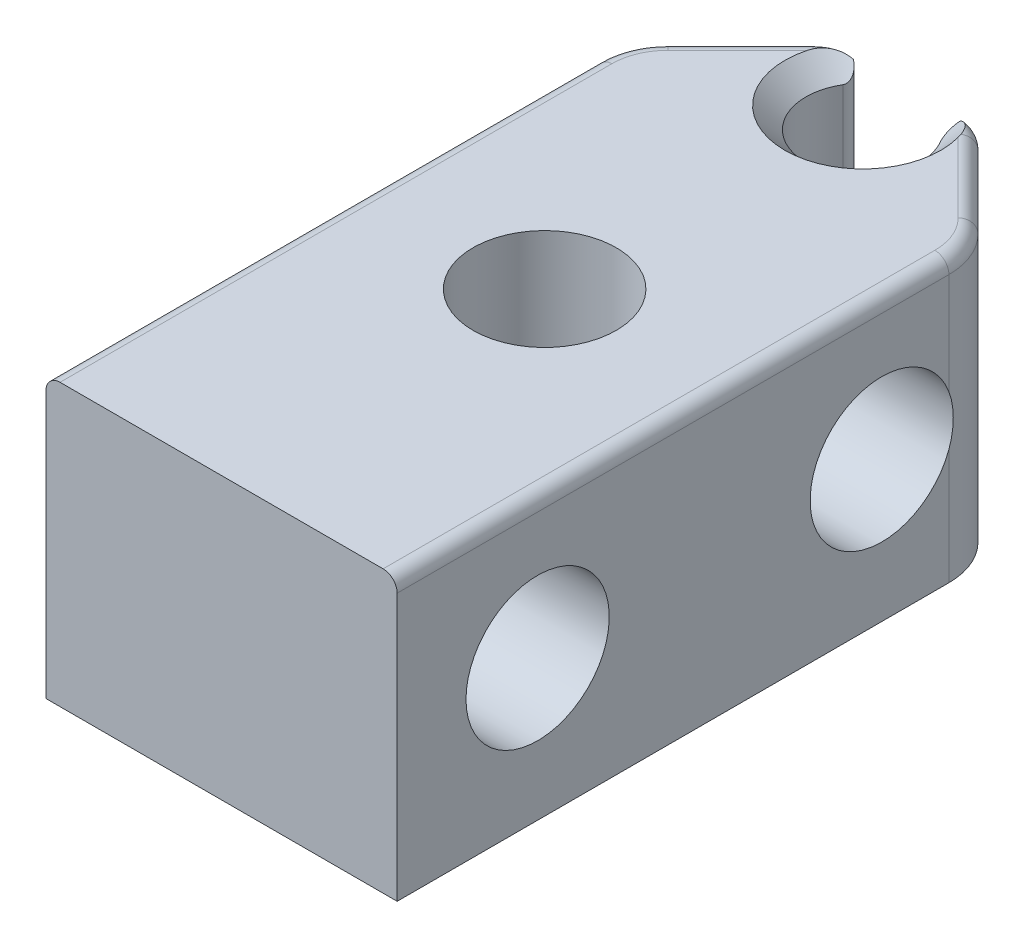
from build123d import *
from OCP.BRepAlgoAPI import BRepAlgoAPI_Cut
from OCP.TopTools import TopTools_ListOfShape

# Parameters (mm, degrees)
SZKIC1_W                               = 25
SZKIC1_H                               = 20
DODANIE_WYCI_GNI_CIE1_DEPTH            = 42.5
WYTNIJ_WYCI_GNI_CIE1_REACH             = 52.312
SZKIC2_R                               = 5.1
WYTNIJ_WYCI_GNI_CIE2_REACH             = 50.606
SZKIC3_R                               = 5.1
DODANIE_WYCI_GNI_CIE2_START            = -20
DODANIE_WYCI_GNI_CIE2_DEPTH            = 20
ZAOKR_GLENIE2_R                        = 0.75
SZKIC7_W                               = 25
SZKIC7_H                               = 15
DODANIE_WYCI_GNI_CIE3_DEPTH            = 2
WYTNIJ_WYCI_GNI_CIE4_REACH             = 49.817
SZKIC8_R                               = 4.05
SFAZOWANIE1_SIZE                       = 7.5
WYCI_CIE_WYCI_GNI_CIE_START            = 5.5
WYCI_CIE_WYCI_GNI_CIE_PO_CIE_CE1_DEPTH = 3
ZAOKR_GLENIE3_R                        = 2
ZAOKR_GLENIE4_START                    = -11
ZAOKR_GLENIE4_DEPTH                    = 22
ZAOKR_GLENIE3_OF_LUSTRO2_R             = 2
ZAOKR_GLENIE5_R                        = 5
ZAOKR_GLENIE6_R                        = 1
SFAZOWANIE2_SIZE                       = 1.5
WYTNIJ_WYCI_GNI_CIE5_REACH             = 52.312
SZKIC12_R                              = 5.1


with BuildPart() as part:
    # Szkic1 → Dodanie-wyciągnięcie1 (new body)
    with BuildSketch(Plane.XY):
        Rectangle(SZKIC1_W, SZKIC1_H)
    extrude(amount=DODANIE_WYCI_GNI_CIE1_DEPTH)

    # Szkic2 → Wytnij-wyciągnięcie1 (cut, up to next)
    with BuildSketch(Plane(origin=(12.5, 0, 0), x_dir=(0, 0, -1), z_dir=(1, 0, 0)), mode=Mode.PRIVATE) as wytnij_wyci_gni_cie1_sk1:
        with Locations((-8, 0)):
            Circle(SZKIC2_R)
    wytnij_wyci_gni_cie1_tool1 = extrude(wytnij_wyci_gni_cie1_sk1.sketch, amount=-WYTNIJ_WYCI_GNI_CIE1_REACH, mode=Mode.PRIVATE) & part.part
    add(wytnij_wyci_gni_cie1_tool1.solids().sort_by_distance((12.5, 0, 8))[0], mode=Mode.SUBTRACT)

    # Szkic3 → Wytnij-wyciągnięcie2 (cut, up to next)
    with BuildSketch(Plane(origin=(0, 10, 0), x_dir=(1, 0, 0), z_dir=(0, 1, 0)), mode=Mode.PRIVATE) as wytnij_wyci_gni_cie2_sk1:
        with Locations(Location((0, -19.5, 0), (0, 0, 270))):
            Circle(SZKIC3_R)
    wytnij_wyci_gni_cie2_tool1 = extrude(wytnij_wyci_gni_cie2_sk1.sketch, amount=-WYTNIJ_WYCI_GNI_CIE2_REACH, mode=Mode.PRIVATE) & part.part
    add(wytnij_wyci_gni_cie2_tool1.solids().sort_by_distance((0, 10, 19.5))[0], mode=Mode.SUBTRACT)

    # Dodanie-wyciągnięcie2: read off the stored shape, not the designer's step
    # Dodanie-wyciągnięcie2 outline → Dodanie-wyciągnięcie2 (add)
    with BuildSketch(Plane(origin=(0, 10, 0), x_dir=(1, 0, 0), z_dir=(0, 1, 0)).offset(DODANIE_WYCI_GNI_CIE2_START)):
        with BuildLine():
            Line((-12.5, 0), (-2.545584412, 0))
            ThreePointArc((-2.545584412, 0), (-4.049799766, 3.19027229), (-2.482438317, 6.35))
            Line((-2.482438317, 6.35), (-12.5, 6.35))
            Line((-12.5, 6.35), (-12.5, 0))
        make_face()
        with BuildLine():
            Line((12.5, 0), (12.5, 6.35))
            Line((12.5, 6.35), (2.482438317, 6.35))
            ThreePointArc((2.482438317, 6.35), (4.049799766, 3.19027229), (2.545584412, 0))
            Line((2.545584412, 0), (12.5, 0))
        make_face()
    extrude(amount=DODANIE_WYCI_GNI_CIE2_DEPTH)

    # Zaokrąglenie2
    zaokr_glenie2_edges = [part.edges().sort_by_distance(p)[0] for p in [
        (-2.482438317, 0, -6.35),
        (2.482438317, 0, -6.35),
    ]]
    fillet(zaokr_glenie2_edges, radius=ZAOKR_GLENIE2_R)

    # Szkic7 → Dodanie-wyciągnięcie3 (add)
    with BuildSketch(Plane.XZ.offset(10)):
        with Locations((0, 1.15)):
            Rectangle(SZKIC7_W, SZKIC7_H)
    extrude(amount=-DODANIE_WYCI_GNI_CIE3_DEPTH)

    # Szkic8 → Wytnij-wyciągnięcie4 (cut, up to next)
    with BuildSketch(Plane(origin=(0, -8, 0), x_dir=(1, 0, 0), z_dir=(0, 1, 0)), mode=Mode.PRIVATE) as wytnij_wyci_gni_cie4_sk1:
        with Locations((0, 3.15)):
            Circle(SZKIC8_R)
    wytnij_wyci_gni_cie4_tool1 = extrude(wytnij_wyci_gni_cie4_sk1.sketch, amount=WYTNIJ_WYCI_GNI_CIE4_REACH, mode=Mode.PRIVATE) & part.part
    add(wytnij_wyci_gni_cie4_tool1.solids().sort_by_distance((0, -8, -3.15))[0], mode=Mode.SUBTRACT)

    # Sfazowanie1
    sfazowanie1_edges = [part.edges().sort_by_distance(p)[0] for p in [
        (-12.5, 0, -6.35),
        (12.5, 0, -6.35),
    ]]
    chamfer(sfazowanie1_edges, length=SFAZOWANIE1_SIZE)


with BuildPart() as wyci_cie_wyci_gni_cie_po_cie_ce1_tool:
    # Wycięcie-wyciągnięcie po ścieżce1: read off the stored shape, not the designer's step
    # Wycięcie-wyciągnięcie po ścieżce1 outlin → Wycięcie-wyciągnięcie po ścieżce1 (new body)
    with BuildSketch(Plane(origin=(0, 0, 0), x_dir=(1, 0, 0), z_dir=(0, 1, 0)).offset(WYCI_CIE_WYCI_GNI_CIE_START)):
        with BuildLine():
            Line((-8.398959236, 2.951040764), (-9.601040764, 1.748959236))
            add(Edge.make_bspline(
                [(-9.601040764, 1.748959236), (-9.209595956, 0.772190109), (-8.65567701, -0.205079485), (-7.121419805, -2.018854383), (-6.15542851, -2.840889353), (-3.89496705, -4.097344098), (-2.618886758, -4.525976788), (0.018436022, -4.858092268), (1.356613032, -4.766181401), (3.844325913, -4.116700841), (4.978679647, -3.572124587), (6.907257886, -2.213562211), (7.697476445, -1.410485572), (8.875702434, 0.189942932), (9.295310391, 0.978883557), (9.600922152, 1.74907375)],
                knots=[0.044527741, 0.044527741, 0.044527741, 0.044527741, 0.163961774, 0.163961774, 0.283395806, 0.283395806, 0.402829838, 0.402829838, 0.522263871, 0.522263871, 0.641697903, 0.641697903, 0.761131935, 0.761131935, 0.869411924, 0.869411924, 0.869411924, 0.869411924], degree=3))
            Line((9.600922152, 1.74907375), (8.398612397, 2.951387603))
            add(Edge.make_bspline(
                [(-8.398959236, 2.951040764), (-8.143623085, 2.110383322), (-7.721254142, 1.22892436), (-6.543030407, -0.407961014), (-5.768609422, -1.171170966), (-3.942260695, -2.384057538), (-2.87593166, -2.830554933), (-0.670426419, -3.287743264), (0.481400093, -3.292782379), (2.627656604, -2.909796026), (3.631791424, -2.516326215), (5.35458893, -1.493813298), (6.079684963, -0.860499), (7.238136236, 0.482263814), (7.674817273, 1.192485201), (8.155489955, 2.24471168), (8.28334822, 2.593485223), (8.398612397, 2.951387603)],
                knots=[0.044527741, 0.044527741, 0.044527741, 0.044527741, 0.163961774, 0.163961774, 0.283395806, 0.283395806, 0.402829838, 0.402829838, 0.522263871, 0.522263871, 0.641697903, 0.641697903, 0.761131935, 0.761131935, 0.880565968, 0.880565968, 0.940774458, 0.940774458, 0.940774458, 0.940774458], degree=3))
        make_face()
    wyci_cie_wyci_gni_cie_po_cie_ce1 = extrude(amount=WYCI_CIE_WYCI_GNI_CIE_PO_CIE_CE1_DEPTH)


with BuildPart() as part_1:
    add(part.part)

    # Wycięcie-wyciągnięcie po ścieżce1: cut by wyci_cie_wyci_gni_cie_po_cie_ce1_tool, with a tolerance
    wyci_cie_wyci_gni_cie_po_cie_ce1_stock = TopTools_ListOfShape()
    wyci_cie_wyci_gni_cie_po_cie_ce1_stock.Append(part_1.part.wrapped)
    wyci_cie_wyci_gni_cie_po_cie_ce1_tools = TopTools_ListOfShape()
    wyci_cie_wyci_gni_cie_po_cie_ce1_tools.Append(wyci_cie_wyci_gni_cie_po_cie_ce1_tool.part.wrapped)
    wyci_cie_wyci_gni_cie_po_cie_ce1_cut = BRepAlgoAPI_Cut()
    wyci_cie_wyci_gni_cie_po_cie_ce1_cut.SetArguments(wyci_cie_wyci_gni_cie_po_cie_ce1_stock)
    wyci_cie_wyci_gni_cie_po_cie_ce1_cut.SetTools(wyci_cie_wyci_gni_cie_po_cie_ce1_tools)
    wyci_cie_wyci_gni_cie_po_cie_ce1_cut.SetFuzzyValue(0.00001)
    wyci_cie_wyci_gni_cie_po_cie_ce1_cut.Build()
    add(Compound.cast(wyci_cie_wyci_gni_cie_po_cie_ce1_cut.Shape()).solids(), mode=Mode.REPLACE)

    # Zaokrąglenie3
    zaokr_glenie3_edges = [part_1.edges().sort_by_distance(p)[0] for p in [
        (-8.398959236, 7, -2.951040764),
        (8.398612397, 7, -2.951387603),
    ]]
    fillet(zaokr_glenie3_edges, radius=ZAOKR_GLENIE3_R)

    # Zaokrąglenie4: read off the stored shape, not the designer's step
    # Zaokrąglenie4 outline → Zaokrąglenie4 (cut)
    with BuildSketch(Plane(origin=(0, 0, 0), x_dir=(1, 0, 0), z_dir=(0, 1, 0)).offset(ZAOKR_GLENIE4_START)):
        with BuildLine():
            Line((5, 6.35), (3.757359313, 6.35))
            ThreePointArc((3.757359313, 6.35), (4.90540961, 6.121638598), (5.878679656, 5.471320344))
            Line((5.878679656, 5.471320344), (5, 6.35))
        make_face()
        with BuildLine():
            ThreePointArc((-5.878679656, 5.471320344), (-4.90540961, 6.121638598), (-3.757359313, 6.35))
            Line((-3.757359313, 6.35), (-5, 6.35))
            Line((-5, 6.35), (-5.878679656, 5.471320344))
        make_face()
    extrude(amount=ZAOKR_GLENIE4_DEPTH, mode=Mode.SUBTRACT)

    # Lustro2: Wycięcie-wyciągnięcie po ścieżce1 across plane
    add(wyci_cie_wyci_gni_cie_po_cie_ce1.mirror(Plane.ZX), mode=Mode.SUBTRACT)

    # Zaokrąglenie3 of Lustro2
    zaokr_glenie3_of_lustro2_edges = [part_1.edges().sort_by_distance(p)[0] for p in [
        (-8.398959236, -7, -2.951040764),
        (8.398612397, -7, -2.951387603),
    ]]
    fillet(zaokr_glenie3_of_lustro2_edges, radius=ZAOKR_GLENIE3_OF_LUSTRO2_R)

    # Zaokrąglenie5
    # the kernel refuses this fillet: 5 mm, written as the material it takes off along each edge
    with BuildSketch(Plane(origin=(-12.5, 15.17766953, 1.15), x_dir=(0.7071067811865477, 0, -0.7071067811865472), z_dir=(0, -1, 0)), Plane(origin=(12.5, -15.17766953, 1.15), x_dir=(-0.7071067811865474, 0, -0.7071067811865476), z_dir=(0, 1, 0))) as zaokr_glenie5_piece_1:
        with BuildLine():
            CenterArc((ZAOKR_GLENIE5_R * 0.414213562373, ZAOKR_GLENIE5_R), ZAOKR_GLENIE5_R, 225, 45)
            Line((-ZAOKR_GLENIE5_R * 0.292893218813, ZAOKR_GLENIE5_R * 0.292893218813), (0, 0))
            Line((0, 0), (ZAOKR_GLENIE5_R * 0.414213562373, 0))
        make_face()
    extrude(amount=30.355339059, mode=Mode.SUBTRACT)

    # Zaokrąglenie6
    zaokr_glenie6_edges = [part_1.edges().sort_by_distance(p)[0] for p in [
        (-8.457106781, 10, -2.892893219),
        (-5.01866332, 10, -6.071968443),
        (5.01866332, 10, -6.071968443),
        (8.457106781, 10, -2.892893219),
        (12.119397663, 10, 1.30765065),
        (-12.119397663, 10, 1.30765065),
        (-12.5, 10, 22.860533906),
        (12.5, 10, 22.860533906),
    ]]
    fillet(zaokr_glenie6_edges, radius=ZAOKR_GLENIE6_R)

    # Sfazowanie2
    # the kernel refuses this chamfer: 1.5 mm, written as the material it takes off along each edge
    with BuildSketch(Plane(origin=(1e-09, 10, -3.15), x_dir=(0.08224322624349094, 0, -0.9966122875707795), z_dir=(-0.9966122875707795, 0, -0.08224322624349094))) as sfazowanie2_piece_1:
        Polygon((4.049999999 + SFAZOWANIE2_SIZE, 0), (4.049999999, SFAZOWANIE2_SIZE), (4.049999999, 0), align=None)
    revolve(axis=Axis((1e-09, 10, -3.15), (0, -1, 0)), revolution_arc=136.340040588, mode=Mode.SUBTRACT)
    with BuildSketch(Plane(origin=(-1e-09, 10, -3.15), x_dir=(-0.6285393608328834, 0, 0.7777777779570398), z_dir=(0.7777777779570398, 0, 0.6285393608328834))) as sfazowanie2_piece_2:
        Polygon((4.049999999 + SFAZOWANIE2_SIZE, 0), (4.049999999, SFAZOWANIE2_SIZE), (4.049999999, 0), align=None)
    revolve(axis=Axis((-1e-09, 10, -3.15), (0, -1, 0)), revolution_arc=136.340040588, mode=Mode.SUBTRACT)
    with BuildSketch(Plane(origin=(0, 10, -3.15), x_dir=(0.6285393610141453, 0, 0.7777777778105581), z_dir=(0.7777777778105581, 0, -0.6285393610141453))) as sfazowanie2_piece_3:
        Polygon((4.05 + SFAZOWANIE2_SIZE, 0), (4.05, SFAZOWANIE2_SIZE), (4.05, 0), align=None)
    revolve(axis=Axis((0, 10, -3.15), (0, -1, 0)), revolution_arc=77.884882532, mode=Mode.SUBTRACT)

    # Szkic12 → Wytnij-wyciągnięcie5 (cut, up to next)
    with BuildSketch(Plane.ZY.offset(12.5), mode=Mode.PRIVATE) as wytnij_wyci_gni_cie5_sk1:
        with Locations((32.5, 0)):
            Circle(SZKIC12_R)
    wytnij_wyci_gni_cie5_tool1 = extrude(wytnij_wyci_gni_cie5_sk1.sketch, amount=-WYTNIJ_WYCI_GNI_CIE5_REACH, mode=Mode.PRIVATE) & part_1.part
    add(wytnij_wyci_gni_cie5_tool1.solids().sort_by_distance((-12.5, 0, 32.5))[0], mode=Mode.SUBTRACT)


solid = part_1.part
